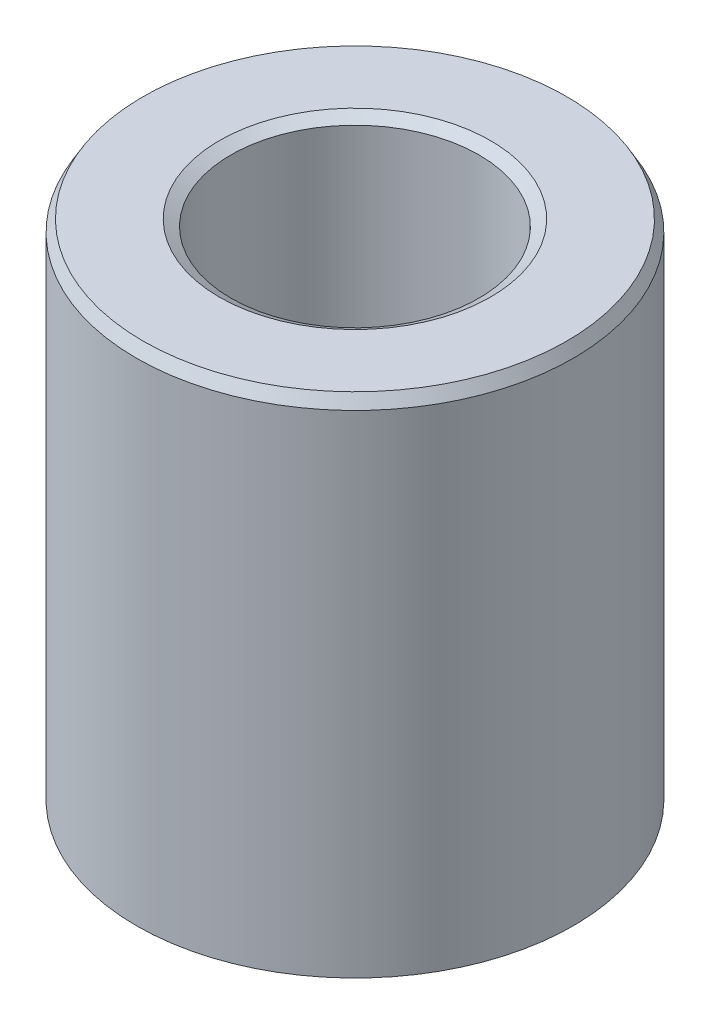
from build123d import *
from OCP.BRepFilletAPI import BRepFilletAPI_MakeChamfer

# Parameters (mm, degrees)
SKETCH1_R           = 52.5
BOSS_EXTRUDE1_DEPTH = 122.499252338
SKETCH2_R           = 29.824177765
CUT_EXTRUDE1_DEPTH  = 144.243034118
CHAMFER1_SIZE       = 2.765405712
CHAMFER1_SIZE2      = 1.596607732


with BuildPart() as part:
    # Sketch1 → Boss-Extrude1 (new body)
    with BuildSketch(Plane(origin=(0, 0, 0), x_dir=(1, 0, 0), z_dir=(0, 1, 0))):
        Circle(SKETCH1_R)
    extrude(amount=BOSS_EXTRUDE1_DEPTH)

    # Sketch2 → Cut-Extrude1 (cut, through all)
    with BuildSketch(Plane(origin=(0, 0, 0), x_dir=(1, 0, 0), z_dir=(0, 1, 0))):
        Circle(SKETCH2_R)
    extrude(amount=CUT_EXTRUDE1_DEPTH, mode=Mode.SUBTRACT)

    # Chamfer1: one chamfer whose edges measure the first distance from different faces: ONE call of the kernel's chamfer builder (chamfer() names one face for all edges)
    chamfer1_edges_1 = [part.edges().sort_by_distance(p)[0] for p in [
        (-29.824177765, 122.499252338, 0),
    ]]
    chamfer1_side_1 = [part.faces().sort_by_distance(p)[0] for p in [
        (-51.01507576, 122.499252338, 0),
    ]]
    chamfer1_edges_2 = [part.edges().sort_by_distance(p)[0] for p in [
        (-29.824177765, 0, 0),
    ]]
    chamfer1_side_2 = [part.faces().sort_by_distance(p)[0] for p in [
        (-29.824177765, 61.249626169, 0),
    ]]
    chamfer1_edges_3 = [part.edges().sort_by_distance(p)[0] for p in [
        (-52.5, 0, 0),
    ]]
    chamfer1_side_3 = [part.faces().sort_by_distance(p)[0] for p in [
        (-51.01507576, 0, 0),
    ]]
    chamfer1_edges_4 = [part.edges().sort_by_distance(p)[0] for p in [
        (-52.5, 122.499252338, 0),
    ]]
    chamfer1_side_4 = [part.faces().sort_by_distance(p)[0] for p in [
        (-52.5, 61.249626169, 0),
    ]]
    chamfer1 = BRepFilletAPI_MakeChamfer(part.part.solid().wrapped)
    for e in chamfer1_edges_1:
        chamfer1.Add(CHAMFER1_SIZE, CHAMFER1_SIZE2, e.wrapped, chamfer1_side_1[0].wrapped)  # the first distance lies on this face
    for e in chamfer1_edges_2:
        chamfer1.Add(CHAMFER1_SIZE, CHAMFER1_SIZE2, e.wrapped, chamfer1_side_2[0].wrapped)  # the first distance lies on this face
    for e in chamfer1_edges_3:
        chamfer1.Add(CHAMFER1_SIZE, CHAMFER1_SIZE2, e.wrapped, chamfer1_side_3[0].wrapped)  # the first distance lies on this face
    for e in chamfer1_edges_4:
        chamfer1.Add(CHAMFER1_SIZE, CHAMFER1_SIZE2, e.wrapped, chamfer1_side_4[0].wrapped)  # the first distance lies on this face
    add(Compound.cast(chamfer1.Shape()), mode=Mode.REPLACE)


solid = part.part
